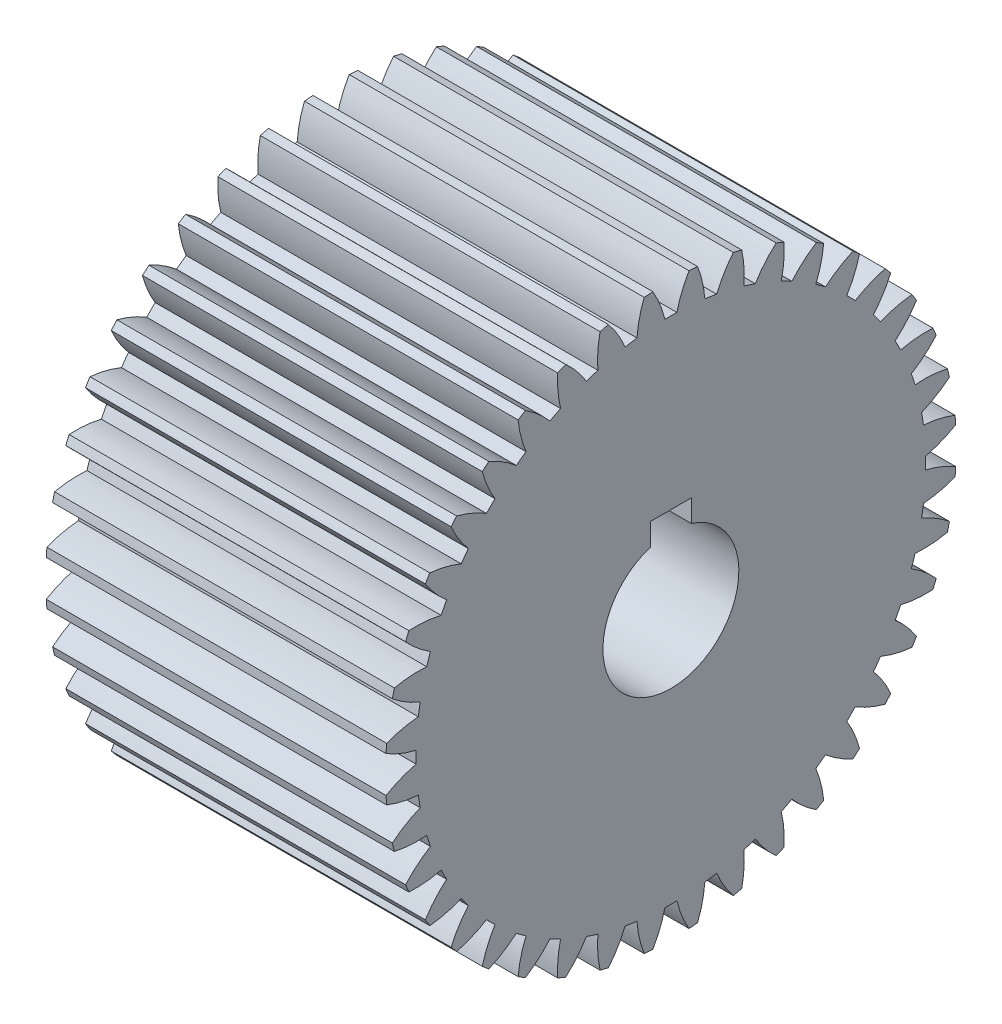
from build123d import *

# Parameters (mm, degrees)
BASPROSKE_W     = 50
BASPROSKE_H     = 42
TOOTHCUT_DEPTH  = 78.640195775
TEETHCUTS_COUNT = 40
TEETHCUTS_ANGLE = 351
BORSKE_R        = 10
BORE_DEPTH      = 50.0000508
KEYSKE_W        = 6
KEYSKE_H        = 12.8
KEYWAY_DEPTH    = 50.0000508


with BuildPart() as part:
    # BasProSke → Base-Revolve (revolve)
    with BuildSketch(Plane(origin=(0, 0, 0), x_dir=(1, 0, 0), z_dir=(0, 1, 0))):
        with Locations((25, 21)):
            Rectangle(BASPROSKE_W, BASPROSKE_H)
    revolve(axis=Axis((-10, 0, 0), (1, 0, 0)))

    # TooCutSke → ToothCut (cut, through all)
    with BuildSketch(Plane(origin=(0, 0, 0), x_dir=(0, 0, -1), z_dir=(1, 0, 0))):
        with BuildLine():
            ThreePointArc((0.882812088, 37.488606854), (0, 37.499), (-0.882812088, 37.488606854))
            ThreePointArc((-0.882812088, 37.488606854), (-1.612748684, 39.782000434), (-2.678427154, 41.939960338))
            ThreePointArc((-2.678427154, 41.939960338), (0, 42.0254), (2.678427154, 41.939960338))
            ThreePointArc((2.678427154, 41.939960338), (1.612748684, 39.782000434), (0.882812088, 37.488606854))
        make_face()
    toothcut = extrude(amount=TOOTHCUT_DEPTH, mode=Mode.SUBTRACT)

    # TeethCuts: ToothCut ×40 about axis
    teethcuts_axis = Axis((-10, 0, 0), (1, 0, 0))
    for i in range(1, TEETHCUTS_COUNT):
        add(toothcut.rotate(teethcuts_axis, i * TEETHCUTS_ANGLE / (TEETHCUTS_COUNT - 1)), mode=Mode.SUBTRACT)

    # BorSke → Bore (cut, symmetric)
    with BuildSketch(Plane(origin=(0, 0, 0), x_dir=(0, 0, -1), z_dir=(1, 0, 0))):
        Circle(BORSKE_R)
    extrude(amount=BORE_DEPTH, both=True, mode=Mode.SUBTRACT)

    # KeySke → Keyway (cut, symmetric)
    with BuildSketch(Plane(origin=(0, 0, 0), x_dir=(0, 0, -1), z_dir=(1, 0, 0))):
        with Locations((0, 6.4)):
            Rectangle(KEYSKE_W, KEYSKE_H)
    extrude(amount=KEYWAY_DEPTH, both=True, mode=Mode.SUBTRACT)


solid = part.part
